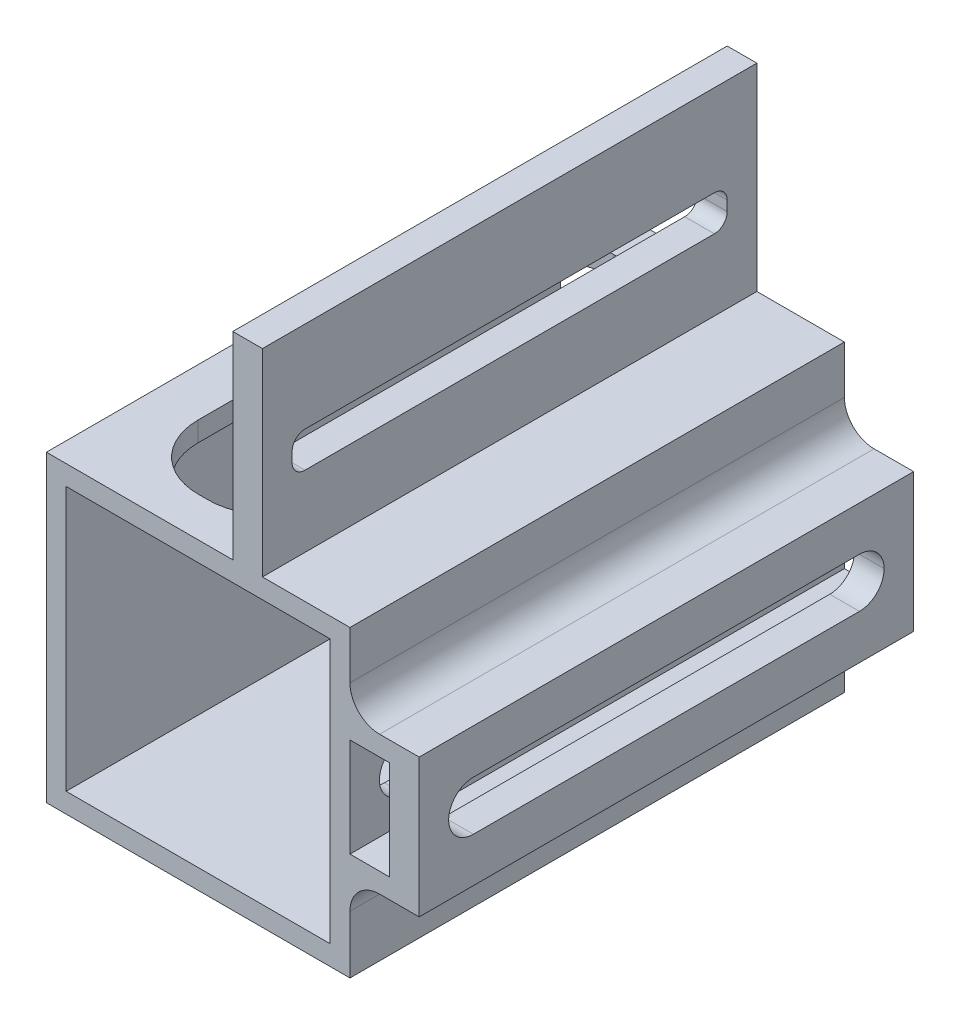
from build123d import *

# Parameters (mm, degrees)
CROQUIS3_W              = 26.7
CROQUIS3_H              = 26.7
CROQUIS3_W_2            = 4
CROQUIS3_H_2            = 25.7
SALIENTE_EXTRUIR1_DEPTH = 50
CORTAR_EXTRUIR14_REACH  = 74.827
REDONDEO2_R             = 2.5
CORTAR_EXTRUIR19_REACH  = 75.253
CROQUIS18_W             = 7
CROQUIS18_H             = 42
CROQUIS19_W             = 4
CROQUIS19_H             = 2
CROQUIS19_W_2           = 3
CROQUIS19_H_2           = 20
SALIENTE_EXTRUIR3_DEPTH = 50
CORTAR_EXTRUIR20_REACH  = 80.262
CROQUIS20_W             = 44
CROQUIS20_H             = 3.6
CORTAR_EXTRUIR21_REACH  = 89.71
REDONDEO6_R             = 3
REDONDEO9_R             = 1.3
CORTAR_EXTRUIR22_REACH  = 75.253
CROQUIS22_W             = 7
CROQUIS22_H             = 42
REDONDEO10_R            = 6.5


with BuildPart() as part:
    # Croquis3 → Saliente-Extruir1 (new body)
    with BuildSketch(Plane.XY):
        Polygon((-43.857247249, 6.480922369), (-6.157247249, 6.480922369), (-6.157247249, 37.180922369), (-27.007247249, 37.180922369), (-43.857247249, 37.180922369), align=None)
        with Locations((-28.507247249, 21.830922369)):
            Rectangle(CROQUIS3_W, CROQUIS3_H, mode=Mode.SUBTRACT)
        with Locations((-11.157247249, 22.330922369)):
            Rectangle(CROQUIS3_W_2, CROQUIS3_H_2, mode=Mode.SUBTRACT)
    extrude(amount=SALIENTE_EXTRUIR1_DEPTH)

    # Cortar-Extruir14: up to this face of the body (flat: up to its plane)
    cortar_extruir14_end = Plane(part.part.faces().sort_by_distance((-15.157247249, 21.830922369, 25))[0])
    # Croquis14 → Cortar-Extruir14 (cut, up to the picked face)
    with BuildSketch(Plane(origin=(-6.157247249, 0, 0), x_dir=(0, 0, -1), z_dir=(1, 0, 0)), mode=Mode.PRIVATE) as cortar_extruir14_sk1:
        Polygon((-2.979356026, 22.330922369), (-2.979356026, 19.830922369), (-47.020643974, 19.830922369), (-47.020643974, 22.330922369), (-47.020643974, 24.830922369), (-2.979356026, 24.830922369), align=None)
    cortar_extruir14_tool1 = split(extrude(cortar_extruir14_sk1.sketch, amount=-CORTAR_EXTRUIR14_REACH, mode=Mode.PRIVATE), bisect_by=cortar_extruir14_end, keep=Keep.BOTH, mode=Mode.PRIVATE)
    add(cortar_extruir14_tool1.solids().sort_by(Axis((-6.157247, 22.330922, 25), (-1, 0, 0)))[0], mode=Mode.SUBTRACT)

    # Redondeo2
    redondeo2_edges = [part.edges().sort_by_distance(p)[0] for p in [
        (-14.157247249, 24.830922369, 2.979356026),
        (-7.657247249, 24.830922369, 2.979356026),
        (-7.657247249, 19.830922369, 2.979356026),
        (-14.157247249, 19.830922369, 2.979356026),
        (-14.157247249, 24.830922369, 47.020643974),
        (-7.657247249, 24.830922369, 47.020643974),
        (-7.657247249, 19.830922369, 47.020643974),
        (-14.157247249, 19.830922369, 47.020643974),
    ]]
    fillet(redondeo2_edges, radius=REDONDEO2_R - 0.0001)  # a hair under: the kernel refuses the full size

    # Croquis18 → Cortar-Extruir19 (cut, up to next)
    with BuildSketch(Plane(origin=(0, 37.180922369, 0), x_dir=(1, 0, 0), z_dir=(0, 1, 0)), mode=Mode.PRIVATE) as cortar_extruir19_sk1:
        with Locations((-28.507247249, -25)):
            Rectangle(CROQUIS18_W, CROQUIS18_H)
    cortar_extruir19_tool1 = extrude(cortar_extruir19_sk1.sketch, amount=-CORTAR_EXTRUIR19_REACH, mode=Mode.PRIVATE) & part.part
    add(cortar_extruir19_tool1.solids().sort_by_distance((-28.507247, 37.180922, 25))[0], mode=Mode.SUBTRACT)

    # Croquis19 → Saliente-Extruir3 (add)
    with BuildSketch(Plane(origin=(0, 0, 0), x_dir=(-1, 0, 0), z_dir=(0, 0, -1))):
        with Locations((11.157247249, 16.330922369)):
            Rectangle(CROQUIS19_W, CROQUIS19_H)
        with Locations((11.157247249, 28.330922369)):
            Rectangle(CROQUIS19_W, CROQUIS19_H)
        with Locations((23.507247249, 47.180922369)):
            Rectangle(CROQUIS19_W_2, CROQUIS19_H_2)
    extrude(amount=-SALIENTE_EXTRUIR3_DEPTH)

    # Croquis20 → Cortar-Extruir20 (cut, up to next)
    with BuildSketch(Plane.ZY.offset(25.007247249), mode=Mode.PRIVATE) as cortar_extruir20_sk1:
        with Locations((25, 46.180922369)):
            Rectangle(CROQUIS20_W, CROQUIS20_H)
    cortar_extruir20_tool1 = extrude(cortar_extruir20_sk1.sketch, amount=-CORTAR_EXTRUIR20_REACH, mode=Mode.PRIVATE) & part.part
    add(cortar_extruir20_tool1.solids().sort_by_distance((-25.007247, 46.180922, 25))[0], mode=Mode.SUBTRACT)

    # Croquis21 → Cortar-Extruir21 (cut, up to next)
    with BuildSketch(Plane(origin=(0, 0, 0), x_dir=(-1, 0, 0), z_dir=(0, 0, -1)), mode=Mode.PRIVATE) as cortar_extruir21_sk1:
        Polygon((13.157247249, 35.180922369), (13.157247249, 37.180922369), (6.157247249, 37.180922369), (6.157247249, 29.330922369), (9.157247249, 29.330922369), (9.157247249, 35.180922369), align=None)
    cortar_extruir21_tool1 = extrude(cortar_extruir21_sk1.sketch, amount=-CORTAR_EXTRUIR21_REACH, mode=Mode.PRIVATE) & part.part
    # Croquis21 → Cortar-Extruir21 (cut, up to next)
    with BuildSketch(Plane(origin=(0, 0, 0), x_dir=(-1, 0, 0), z_dir=(0, 0, -1)), mode=Mode.PRIVATE) as cortar_extruir21_sk2:
        Polygon((6.157247249, 9.480922369), (6.157247249, 15.330922369), (9.157247249, 15.330922369), (9.157247249, 9.480922369), (13.157247249, 9.480922369), (13.157247249, 6.480922369), (6.157247249, 6.480922369), align=None)
    cortar_extruir21_tool2 = extrude(cortar_extruir21_sk2.sketch, amount=-CORTAR_EXTRUIR21_REACH, mode=Mode.PRIVATE) & part.part
    add(cortar_extruir21_tool1.solids().sort_by_distance((-8.544727, 33.997602, 0))[0], mode=Mode.SUBTRACT)
    add(cortar_extruir21_tool2.solids().sort_by_distance((-8.746741, 9.995417, 0))[0], mode=Mode.SUBTRACT)

    # Redondeo6
    redondeo6_edges = [part.edges().sort_by_distance(p)[0] for p in [
        (-13.157247249, 15.330922369, 25),
        (-13.157247249, 29.330922369, 25),
    ]]
    fillet(redondeo6_edges, radius=REDONDEO6_R)

    # Redondeo9
    redondeo9_edges = [part.edges().sort_by_distance(p)[0] for p in [
        (-23.507247249, 47.980922369, 3),
        (-23.507247249, 47.980922369, 47),
        (-23.507247249, 44.380922369, 47),
        (-23.507247249, 44.380922369, 3),
    ]]
    fillet(redondeo9_edges, radius=REDONDEO9_R)

    # Croquis22 → Cortar-Extruir22 (cut, up to next)
    with BuildSketch(Plane(origin=(0, 37.180922369, 0), x_dir=(1, 0, 0), z_dir=(0, 1, 0)), mode=Mode.PRIVATE) as cortar_extruir22_sk1:
        with Locations((-35.507247249, -25)):
            Rectangle(CROQUIS22_W, CROQUIS22_H)
    cortar_extruir22_tool1 = extrude(cortar_extruir22_sk1.sketch, amount=-CORTAR_EXTRUIR22_REACH, mode=Mode.PRIVATE) & part.part
    add(cortar_extruir22_tool1.solids().sort_by_distance((-35.507247, 37.180922, 25))[0], mode=Mode.SUBTRACT)

    # Redondeo10
    redondeo10_edges = [part.edges().sort_by_distance(p)[0] for p in [
        (-25.007247249, 36.180922369, 46),
        (-25.007247249, 36.180922369, 4),
        (-39.007247249, 36.180922369, 4),
        (-39.007247249, 36.180922369, 46),
    ]]
    fillet(redondeo10_edges, radius=REDONDEO10_R)


solid = part.part
